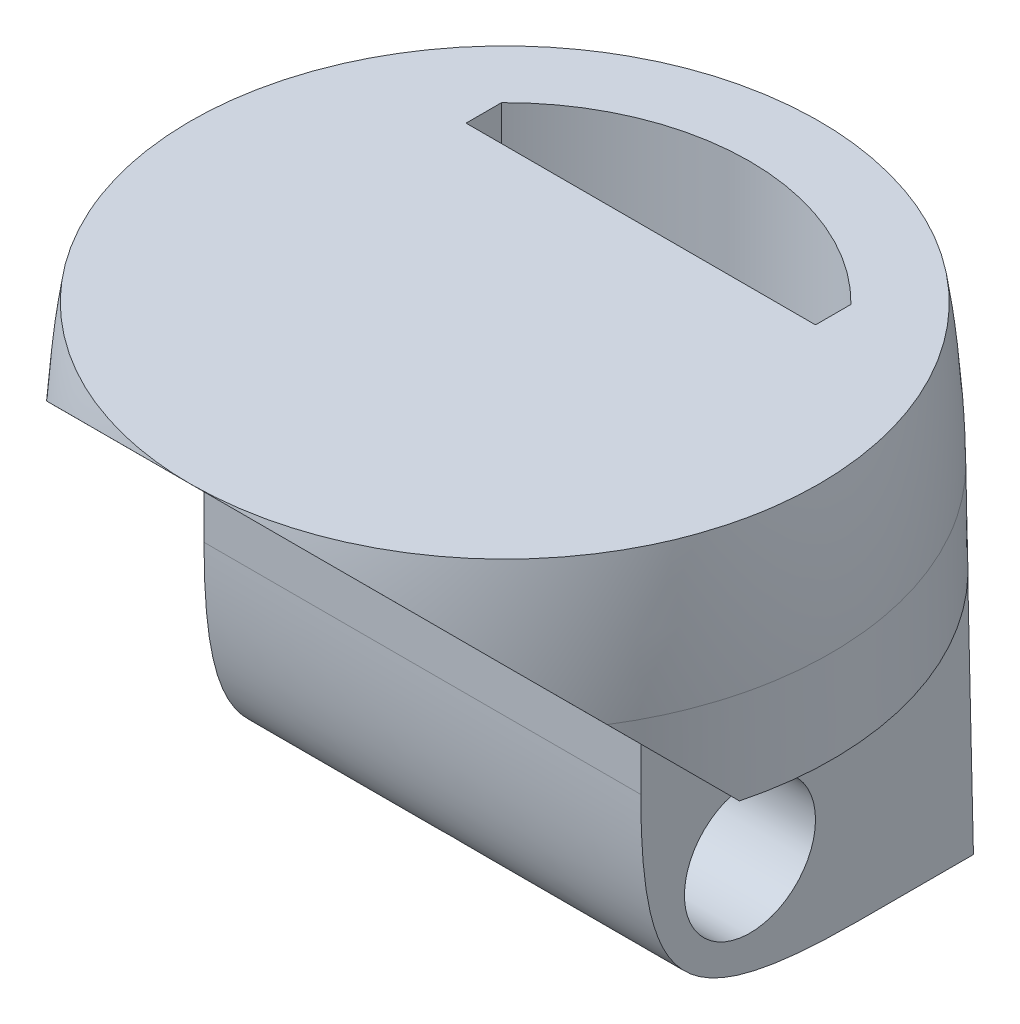
from build123d import *
from build123d.topology import SkipClean

# Parameters (mm, degrees)
SKETCH1_R                     = 7.5
BOSS_EXTRUDE1_DEPTH           = 12
BOSS_EXTRUDE1_TAPER           = 1
BOSS_EXTRUDE1_OTHER_WAY_DEPTH = 6
BOSS_EXTRUDE1_OTHER_WAY_TAPER = -1
CUT_EXTRUDE1_DEPTH            = 17.114088513
CUT_EXTRUDE1_DEPTH_BACK       = 17.114088513
CUT_EXTRUDE2_START            = -9.490788257
CUT_EXTRUDE2_OUTLINE_W        = 6.502745185
CUT_EXTRUDE2_OUTLINE_H        = 6
CUT_EXTRUDE2_DEPTH            = 9.490788257
SKETCH5_R                     = 1.5
CUT_EXTRUDE3_DEPTH            = 19.923052891
FILLET1_SIZE                  = 5
CUT_EXTRUDE4_DEPTH            = 17.064928563
CUT_EXTRUDE4_DEPTH_BACK       = 17.064928563
SKETCH6_W                     = 15.381516612
SKETCH6_H                     = 10.430951858
CUT_EXTRUDE5_DEPTH            = 16.556224591


with BuildPart() as part:
    # Sketch1 → Boss-Extrude1 (new body)
    with BuildSketch(Plane(origin=(0, 0, 0), x_dir=(1, 0, 0), z_dir=(0, 1, 0))):
        Circle(SKETCH1_R)
    extrude(amount=BOSS_EXTRUDE1_DEPTH, taper=BOSS_EXTRUDE1_TAPER)

    # Sketch1 → Boss-Extrude1 other way (add)
    with BuildSketch(Plane(origin=(0, 0, 0), x_dir=(1, 0, 0), z_dir=(0, 1, 0))):
        Circle(SKETCH1_R)
    extrude(amount=-BOSS_EXTRUDE1_OTHER_WAY_DEPTH, taper=BOSS_EXTRUDE1_OTHER_WAY_TAPER)

    # Sketch3 → Cut-Extrude1 (cut, two sides: drawn at the far end of the back side and taken through both)
    with BuildSketch(Plane(origin=(0, 0, 0), x_dir=(0, 0, -1), z_dir=(1, 0, 0)).offset(-CUT_EXTRUDE1_DEPTH_BACK)):
        Polygon((-1.886057768, -6), (-1.886057768, 0), (-9.929766736, 8.043708969), (-9.929766736, -6), align=None)
    extrude(amount=CUT_EXTRUDE1_DEPTH + CUT_EXTRUDE1_DEPTH_BACK, mode=Mode.SUBTRACT)

    # Cut-Extrude2: read off the stored shape, not the designer's step
    # Cut-Extrude2 outline → Cut-Extrude2 (cut)
    with BuildSketch(Plane.XY.offset(1.886057768).offset(CUT_EXTRUDE2_START)):
        with Locations((-8.251372593, -3)):
            Rectangle(CUT_EXTRUDE2_OUTLINE_W, CUT_EXTRUDE2_OUTLINE_H)
        with Locations((8.251372593, -3)):
            Rectangle(CUT_EXTRUDE2_OUTLINE_W, CUT_EXTRUDE2_OUTLINE_H)
    extrude(amount=CUT_EXTRUDE2_DEPTH, mode=Mode.SUBTRACT)

    # Sketch5 → Cut-Extrude3 (cut, through all)
    with BuildSketch(Plane(origin=(5, 0, 0), x_dir=(0, 0, -1), z_dir=(1, 0, 0))):
        with Locations((0.613942232, -3.5)):
            Circle(SKETCH5_R)
    extrude(amount=-CUT_EXTRUDE3_DEPTH, mode=Mode.SUBTRACT)

    # Fillet1
    # a fillet whose section is not a circle: 5 mm, written as the material it takes off along each edge
    with BuildSketch(Plane(origin=(17.5, -6, 1.886057768), x_dir=(0, 0, -1), z_dir=(-1, 0, 0))) as fillet1_piece_1:
        with BuildLine():
            Bezier((FILLET1_SIZE, 0), (0, 0), (0, -FILLET1_SIZE), weights=[1, 1.5, 1])
            Line((0, -FILLET1_SIZE), (0, 0))
            Line((0, 0), (FILLET1_SIZE, 0))
        make_face()
    extrude(amount=35, mode=Mode.SUBTRACT)

    # Fillet2
    # a fillet whose section is not a circle: 10, 5 mm, written as the material it takes off along each edge
    with BuildSketch(Plane(origin=(0, 12, 0), x_dir=(1, 0, 0), z_dir=(0, 0, -1))) as fillet2_piece_1:
        with BuildLine():
            Bezier((7.463566706, 9.912737968), (7.290539221, 0), (2.46432823, 0), weights=[1, 0.818181818, 1])
            Line((2.46432823, 0), (7.290539221, 0))
            Line((7.290539221, 0), (7.463566706, 9.912737968))
        make_face()
    revolve(axis=Axis((0, 12, 0), (0, -1, 0)), mode=Mode.SUBTRACT)

    # Sketch6 → Cut-Extrude4 (cut, two sides: drawn at the far end of the back side and taken through both)
    with SkipClean():  # the faces are left unmerged after this step: merging them gives an invalid solid
        with BuildSketch(Plane(origin=(0, 0, 0), x_dir=(0, 0, -1), z_dir=(1, 0, 0)).offset(-CUT_EXTRUDE4_DEPTH_BACK)):
            with Locations((0.494784802, 10.525391664)):
                Rectangle(SKETCH6_W, SKETCH6_H)
        extrude(amount=CUT_EXTRUDE4_DEPTH + CUT_EXTRUDE4_DEPTH_BACK, mode=Mode.SUBTRACT)
    add(part.part.scale(1), mode=Mode.REPLACE)  # the faces are merged on a copy

    # Sketch7 → Cut-Extrude5 (cut, through all)
    with BuildSketch(Plane.XZ.offset(6)):
        with BuildLine():
            Line((4, -3.113942232), (4, -3.925939727))
            ThreePointArc((4, -3.925939727), (0, -5.60473039), (-4, -3.925939727))
            Line((-4, -3.925939727), (-4, -3.113942232))
            Line((-4, -3.113942232), (4, -3.113942232))
        make_face()
    extrude(amount=-CUT_EXTRUDE5_DEPTH, mode=Mode.SUBTRACT)


solid = part.part
